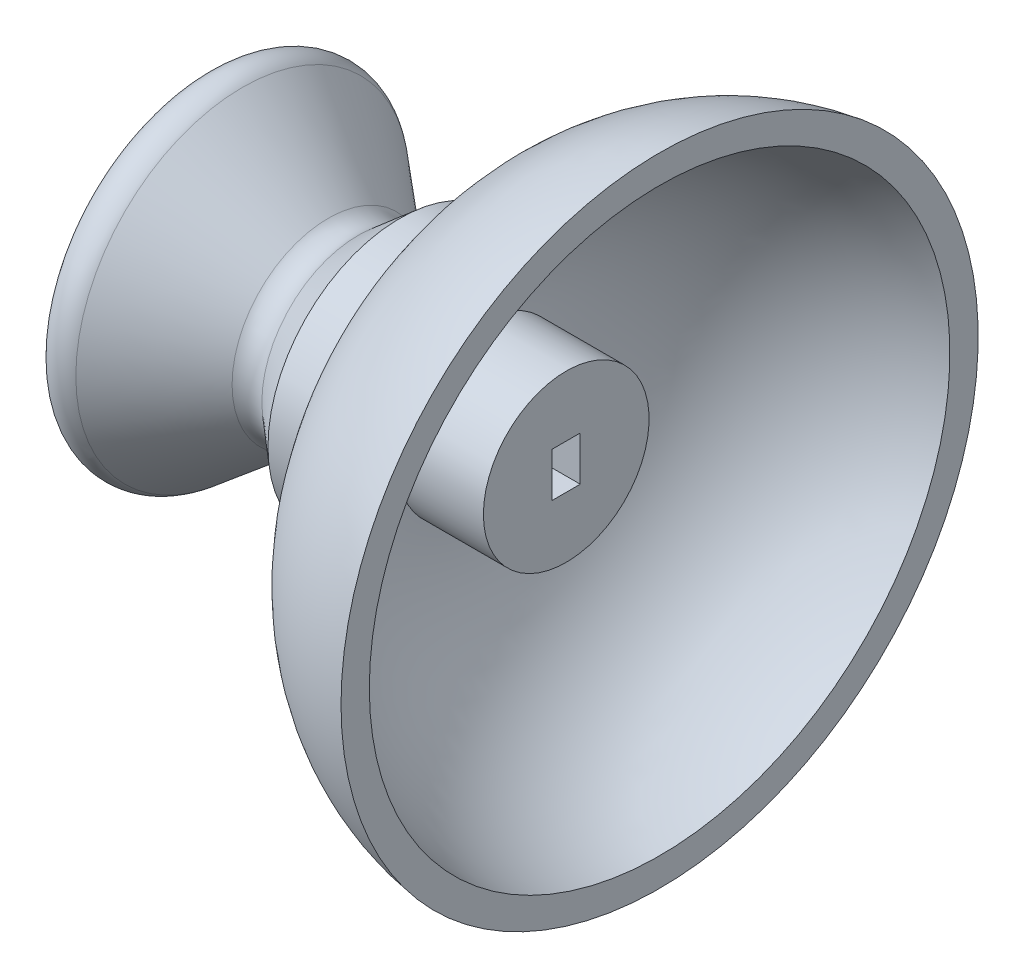
from build123d import *

# Parameters (mm, degrees)
ESQUISSE3_W      = 1.2
ESQUISSE3_H      = 1.9
EXTRUSION2_DEPTH = 4.3
EXTRUSION3_START = -19.35
EXTRUSION3_DEPTH = 1


# Read off the part's stored shape, not the designer's step: Extrusion3
with BuildPart() as part:
    # Esquisse1 → Révolution3 (revolve)
    with BuildSketch(Plane.XY, mode=Mode.PRIVATE) as r_volution3_sk:
        with BuildLine():
            ThreePointArc((-14.261108783, 0.591085315), (-14.902033267, 0.35207293), (-15.546644106, 0.580957137))
            Line((-15.546644106, 0.580957137), (-19.213267485, 3.608715497))
            ThreePointArc((-19.213267485, 3.608715497), (-20.276185104, 3.742266719), (-20.85, 2.837630739))
            Line((-20.85, 2.837630739), (-20.85, 2.110267059))
            Line((-20.85, 2.110267059), (-19.35, -0.039732941))
            Line((-19.35, -0.039732941), (-19.35, -3.539732941))
            Line((-19.35, -3.539732941), (-5.35, -3.539732941))
            Line((-5.35, -3.539732941), (-5.35, 0.010267059))
            Line((-5.35, 0.010267059), (-8.999994144, 0.010267059))
            ThreePointArc((-8.999994144, 0.010267059), (-6.821240137, 5.871173902), (-1.35, 8.89817397))
            Line((-1.35, 8.89817397), (-1.35, 10.110267059))
            ThreePointArc((-1.35, 10.110267059), (-6.934576943, 7.480083062), (-9.979317258, 2.110267059))
            Line((-9.979317258, 2.110267059), (-12.479317258, 2.110267059))
            Line((-12.479317258, 2.110267059), (-14.261108783, 0.591085315))
        make_face()
    revolve(r_volution3_sk.sketch.rotate(Axis((-25.585387416, -3.539732941, 0), (1, 0, 0)), 90), axis=Axis((-25.585387416, -3.539732941, 0), (1, 0, 0)))

    # Esquisse3 → Extrusion2 (cut)
    with BuildSketch(Plane(origin=(-5.35, 0, 0), x_dir=(0, 0, -1), z_dir=(1, 0, 0))):
        with Locations((0, -3.539732941)):
            Rectangle(ESQUISSE3_W, ESQUISSE3_H)
    extrude(amount=-EXTRUSION2_DEPTH, mode=Mode.SUBTRACT)

    # Extrusion3 outline → Extrusion3 (cut)
    with BuildSketch(Plane.YZ.offset(EXTRUSION3_START)):
        with BuildLine():
            add(Edge.make_bspline(
                [(-3.30474087, -3.428116801), (-3.263574617, -3.427584563), (-3.18176531, -3.426526851), (-3.060308003, -3.413701335), (-2.94100731, -3.395299917), (-2.823960754, -3.368252862), (-2.709090162, -3.334156598), (-2.596342199, -3.291603112), (-2.485650327, -3.242058216), (-2.377776459, -3.18447272), (-2.274152046, -3.12038826), (-2.175194243, -3.05083804), (-2.082705178, -2.974834439), (-1.99551353, -2.89361864), (-1.914714683, -2.80622165), (-1.839560572, -2.713462226), (-1.769950386, -2.615268883), (-1.706980551, -2.511332703), (-1.650416931, -2.403205019), (-1.600827719, -2.291145017), (-1.559844404, -2.175186906), (-1.525070624, -2.056199429), (-1.499355483, -1.933281928), (-1.480706738, -1.807326391), (-1.467946138, -1.677676279), (-1.466919883, -1.59004025), (-1.466399524, -1.545604782)],
                knots=[0, 0, 0, 0, 0.04203938, 0.083544465, 0.124643057, 0.165303063, 0.206170747, 0.24697072, 0.288329266, 0.329986533, 0.371797473, 0.412737629, 0.453459281, 0.494001342, 0.534380668, 0.574951545, 0.615891702, 0.657249559, 0.699006607, 0.740486274, 0.782325156, 0.824567455, 0.867041244, 0.910499531, 0.954619176, 1, 1, 1, 1], degree=3))
            add(Edge.make_bspline(
                [(-1.466399524, -1.545604782), (-1.466979016, -1.509366538), (-1.46812808, -1.437510359), (-1.476092728, -1.330584627), (-1.488716609, -1.225311613), (-1.505943396, -1.121535223), (-1.529407086, -1.019608856), (-1.557485371, -0.919242151), (-1.590177193, -0.820289615), (-1.62916604, -0.723061366), (-1.673419665, -0.62690365), (-1.723233087, -0.531281809), (-1.779458092, -0.436522563), (-1.842261627, -0.342461582), (-1.910565045, -0.248505724), (-1.986321869, -0.156141081), (-2.066544624, -0.063138137), (-2.124226808, -0.003336323), (-2.153498883, 0.027011404)],
                knots=[0, 0, 0, 0, 0.061616945, 0.122179161, 0.18221627, 0.241864129, 0.300960056, 0.359969068, 0.419032918, 0.478068687, 0.537992581, 0.59896023, 0.661321079, 0.725247569, 0.791220154, 0.858745972, 0.928317581, 1, 1, 1, 1], degree=3))
            Line((-2.153498883, 0.027011404), (-2.408707216, -0.242219365))
            add(Edge.make_bspline(
                [(-2.408707216, -0.242219365), (-2.362876353, -0.290938253), (-2.27230749, -0.3872143), (-2.154796495, -0.544174543), (-2.054130395, -0.707938177), (-1.972224159, -0.877650673), (-1.906871398, -1.049109227), (-1.860343258, -1.220038004), (-1.83067072, -1.388683705), (-1.827122351, -1.500850923), (-1.825373883, -1.556121609)],
                knots=[0, 0, 0, 0, 0.136144491, 0.269042539, 0.398516618, 0.527099539, 0.652282545, 0.771680405, 0.887494932, 1, 1, 1, 1], degree=3))
            add(Edge.make_bspline(
                [(-1.825373883, -1.556121609), (-1.825787489, -1.590036309), (-1.826613628, -1.657777749), (-1.837157843, -1.758399693), (-1.852322707, -1.85796633), (-1.874264585, -1.956289705), (-1.902073644, -2.053560992), (-1.936859108, -2.149441884), (-1.977414352, -2.244111239), (-2.024276826, -2.33667732), (-2.075756672, -2.426417823), (-2.132805213, -2.511174659), (-2.193594003, -2.591488058), (-2.259644982, -2.665848483), (-2.330359847, -2.73468367), (-2.404423154, -2.799632042), (-2.483858372, -2.858409337), (-2.567203998, -2.911500502), (-2.652996187, -2.958862121), (-2.740409177, -3.000670774), (-2.829153031, -3.035767862), (-2.919339109, -3.063537318), (-3.010269699, -3.086447972), (-3.10257442, -3.102565579), (-3.196352105, -3.111652301), (-3.259149363, -3.113224081), (-3.290718434, -3.114014237)],
                knots=[0, 0, 0, 0, 0.042841197, 0.085571284, 0.127718668, 0.170068387, 0.212787245, 0.255481593, 0.298877091, 0.342860572, 0.386527586, 0.429532376, 0.471886213, 0.513729302, 0.555081706, 0.596535237, 0.638120075, 0.679822212, 0.721331468, 0.761888364, 0.802199329, 0.841806293, 0.881060412, 0.920633226, 0.960101199, 1, 1, 1, 1], degree=3))
            add(Edge.make_bspline(
                [(-3.290718434, -3.114014237), (-3.322989252, -3.113258519), (-3.387442765, -3.111749146), (-3.483636838, -3.102088826), (-3.57840224, -3.084160586), (-3.672050373, -3.060192877), (-3.764741621, -3.030212061), (-3.856074131, -2.992839395), (-3.946044522, -2.948573795), (-4.033842139, -2.897337243), (-4.119365162, -2.841151039), (-4.199924684, -2.778207958), (-4.276593461, -2.711347375), (-4.347669225, -2.638133475), (-4.415053122, -2.560913933), (-4.476888643, -2.477381657), (-4.534366867, -2.389179196), (-4.586763386, -2.296171984), (-4.633571922, -2.199369202), (-4.675195818, -2.100112449), (-4.709475155, -1.998084633), (-4.737413259, -1.893821944), (-4.760313556, -1.787448672), (-4.775046037, -1.678424869), (-4.785736868, -1.567552161), (-4.786518538, -1.492813529), (-4.786912345, -1.45516007)],
                knots=[0, 0, 0, 0, 0.038994203, 0.077881926, 0.116651567, 0.155416065, 0.194618293, 0.234261464, 0.274547108, 0.315667309, 0.357019556, 0.398082512, 0.439097864, 0.479833278, 0.521274132, 0.562840828, 0.605292061, 0.64840866, 0.691727292, 0.735148885, 0.778368925, 0.821660858, 0.865523699, 0.909731498, 0.954522565, 1, 1, 1, 1], degree=3))
            add(Edge.make_bspline(
                [(-4.786912345, -1.45516007), (-4.785963768, -1.409781723), (-4.784101085, -1.320673966), (-4.769600795, -1.189687523), (-4.746954001, -1.063884452), (-4.713788105, -0.943618249), (-4.67148443, -0.828749228), (-4.620489043, -0.718856287), (-4.558845984, -0.614804628), (-4.489272117, -0.516281455), (-4.411757285, -0.425524269), (-4.32811283, -0.343670145), (-4.238744763, -0.272024656), (-4.144179448, -0.209519957), (-4.043634143, -0.157811303), (-3.93760158, -0.115368507), (-3.826034068, -0.082835216), (-3.748942436, -0.069480241), (-3.709989268, -0.062732186)],
                knots=[0, 0, 0, 0, 0.070630068, 0.138693613, 0.204917715, 0.269440883, 0.332636335, 0.395301694, 0.457763931, 0.52065702, 0.582851652, 0.643315198, 0.702580232, 0.760907539, 0.819489613, 0.878269076, 0.938491311, 1, 1, 1, 1], degree=3))
            Line((-3.709989268, -0.062732186), (-3.709989268, -1.229398852))
            Line((-3.709989268, -1.229398852), (-3.351014909, -1.229398852))
            Line((-3.351014909, -1.229398852), (-3.351014909, 0.251370378))
            add(Edge.make_bspline(
                [(-3.351014909, 0.251370378), (-3.417922397, 0.24966453), (-3.548872439, 0.246325877), (-3.73984271, 0.222906961), (-3.920214403, 0.185090449), (-4.090177475, 0.133430137), (-4.249491068, 0.066554856), (-4.398316934, -0.014817672), (-4.535693615, -0.111989793), (-4.662742618, -0.221500235), (-4.776071831, -0.344400192), (-4.875677769, -0.477368812), (-4.959580384, -0.620625781), (-5.027841046, -0.774035588), (-5.081115041, -0.937096022), (-5.118886618, -1.110184401), (-5.141516581, -1.293066002), (-5.144407961, -1.418402679), (-5.145886704, -1.48250382)],
                knots=[0, 0, 0, 0, 0.071272278, 0.139492722, 0.204635419, 0.26740574, 0.328445598, 0.388397163, 0.447733931, 0.507391621, 0.566767555, 0.625478338, 0.684066506, 0.743248446, 0.804033357, 0.866498751, 0.931723238, 1, 1, 1, 1], degree=3))
            add(Edge.make_bspline(
                [(-5.145886704, -1.48250382), (-5.145317582, -1.522013956), (-5.144195092, -1.599940677), (-5.136217744, -1.715031605), (-5.123937168, -1.826949225), (-5.105392045, -1.935677234), (-5.08267739, -2.041615576), (-5.053590672, -2.144235161), (-5.019921972, -2.243926903), (-4.981626299, -2.340844889), (-4.937254642, -2.434109436), (-4.887945003, -2.524135953), (-4.833951642, -2.611422078), (-4.774340796, -2.695373243), (-4.709558336, -2.776426865), (-4.639474417, -2.854060308), (-4.564303297, -2.928708187), (-4.510924288, -2.97546865), (-4.484027729, -2.999030263)],
                knots=[0, 0, 0, 0, 0.069236524, 0.136556739, 0.202094157, 0.26646426, 0.329768823, 0.391878966, 0.453270593, 0.514114664, 0.57438951, 0.634141664, 0.693923287, 0.754152196, 0.814470164, 0.87566063, 0.937348011, 1, 1, 1, 1], degree=3))
            add(Edge.make_bspline(
                [(-4.484027729, -2.999030263), (-4.441357076, -3.033216195), (-4.356724059, -3.101020607), (-4.221124115, -3.188298764), (-4.080722254, -3.262700167), (-3.935127626, -3.323067989), (-3.784476413, -3.370206075), (-3.628961122, -3.404012328), (-3.468381491, -3.423819617), (-3.359716227, -3.426673155), (-3.30474087, -3.428116801)],
                knots=[0, 0, 0, 0, 0.127895677, 0.253668418, 0.376738432, 0.499344473, 0.621999307, 0.745698548, 0.871345153, 1, 1, 1, 1], degree=3))
        make_face()
        with BuildLine():
            add(Edge.make_bspline(
                [(-2.534909139, 2.674447301), (-2.511027741, 2.673811559), (-2.463962091, 2.672558633), (-2.394956332, 2.661500936), (-2.328391518, 2.64479043), (-2.264062899, 2.620845172), (-2.202617247, 2.589238431), (-2.143979766, 2.550765052), (-2.087290801, 2.506374988), (-2.034137503, 2.455023719), (-1.985456298, 2.398612199), (-1.942332212, 2.339017949), (-1.906293101, 2.275967845), (-1.876749604, 2.209727723), (-1.853574223, 2.140482254), (-1.837515644, 2.068097508), (-1.82743316, 1.992773492), (-1.826068988, 1.941339996), (-1.825373883, 1.915132398)],
                knots=[0, 0, 0, 0, 0.061965401, 0.122121906, 0.180988497, 0.239933216, 0.299905831, 0.359988847, 0.421775742, 0.486575826, 0.551534805, 0.615017543, 0.677258617, 0.739729962, 0.803050103, 0.866495132, 0.931973474, 1, 1, 1, 1], degree=3))
            add(Edge.make_bspline(
                [(-1.825373883, 1.915132398), (-1.826088915, 1.887761565), (-1.827493121, 1.834009769), (-1.837315785, 1.755090736), (-1.854261625, 1.679804958), (-1.877438299, 1.607963055), (-1.906896848, 1.539443469), (-1.943588593, 1.474579425), (-1.987372086, 1.413516536), (-2.037012642, 1.356140013), (-2.092280244, 1.303276034), (-2.153890207, 1.256829158), (-2.220717622, 1.216245144), (-2.292582173, 1.18083591), (-2.370135953, 1.15208022), (-2.453103657, 1.13010707), (-2.541125039, 1.112720223), (-2.601910124, 1.106911702), (-2.633066191, 1.103934481)],
                knots=[0, 0, 0, 0, 0.064438672, 0.126546911, 0.186887153, 0.245877536, 0.304040885, 0.362191218, 0.420975933, 0.480660283, 0.540600275, 0.600689098, 0.66193579, 0.724442506, 0.789038394, 0.856313757, 0.926352028, 1, 1, 1, 1], degree=3))
            Line((-2.633066191, 1.103934481), (-2.633066191, 0.789831917))
            add(Edge.make_bspline(
                [(-2.633066191, 0.789831917), (-2.591395303, 0.79187907), (-2.509554788, 0.795899624), (-2.390230882, 0.814727913), (-2.276176083, 0.84166879), (-2.168306169, 0.879760244), (-2.065667362, 0.927066522), (-1.968667346, 0.983796549), (-1.877676158, 1.0509904), (-1.793537314, 1.127197134), (-1.716349744, 1.209965773), (-1.649694501, 1.299271713), (-1.593376829, 1.39311674), (-1.546295588, 1.491216139), (-1.510955742, 1.594676702), (-1.484734102, 1.70255956), (-1.468957756, 1.815338697), (-1.467261971, 1.892178719), (-1.466399524, 1.931258199)],
                knots=[0, 0, 0, 0, 0.068790794, 0.135103289, 0.198978674, 0.2619043, 0.323494969, 0.385195378, 0.446969239, 0.509764777, 0.572250569, 0.633405176, 0.693251163, 0.752583163, 0.812579266, 0.873275085, 0.935549943, 1, 1, 1, 1], degree=3))
            add(Edge.make_bspline(
                [(-1.466399524, 1.931258199), (-1.46729798, 1.969636273), (-1.469063415, 2.045047818), (-1.484224445, 2.155109832), (-1.507970036, 2.259887127), (-1.541285453, 2.359174893), (-1.58606988, 2.452180958), (-1.639867419, 2.539604002), (-1.70208725, 2.622484813), (-1.775341063, 2.697091597), (-1.853543448, 2.765599676), (-1.937031351, 2.824701931), (-2.023260637, 2.875315094), (-2.112888839, 2.917502774), (-2.206759867, 2.948558913), (-2.30350707, 2.972137121), (-2.404131881, 2.985464535), (-2.472238437, 2.987509958), (-2.506864268, 2.988549866)],
                knots=[0, 0, 0, 0, 0.06947546, 0.136516798, 0.200788824, 0.263829673, 0.325735023, 0.387290692, 0.449509219, 0.51296782, 0.576275215, 0.6375801, 0.697902606, 0.757172088, 0.816598528, 0.876653171, 0.937289642, 1, 1, 1, 1], degree=3))
            add(Edge.make_bspline(
                [(-2.506864268, 2.988549866), (-2.555612102, 2.986856603), (-2.652252316, 2.983499791), (-2.794267179, 2.954785415), (-2.931860598, 2.909938904), (-3.0425979, 2.855941547), (-3.131831394, 2.801469103), (-3.205300098, 2.752381595), (-3.284405567, 2.694916784), (-3.368882904, 2.628238286), (-3.459393809, 2.553725414), (-3.555883605, 2.470703251), (-3.657355375, 2.378579769), (-3.726660976, 2.313921268), (-3.762573402, 2.280416853)],
                knots=[0, 0, 0, 0, 0.098702196, 0.195672309, 0.292422427, 0.391342544, 0.444462441, 0.504228775, 0.570352338, 0.642545753, 0.722287505, 0.807921123, 0.900469538, 1, 1, 1, 1], degree=3))
            Line((-3.762573402, 2.280416853), (-4.697168755, 1.404715731))
            Line((-4.697168755, 1.404715731), (-4.697168755, 3.03342166))
            Line((-4.697168755, 3.03342166), (-5.056143114, 3.03342166))
            Line((-5.056143114, 3.03342166), (-5.056143114, 0.655216532))
            Line((-5.056143114, 0.655216532), (-3.607625486, 2.012588327))
            add(Edge.make_bspline(
                [(-3.607625486, 2.012588327), (-3.573127179, 2.045636214), (-3.506862992, 2.109114441), (-3.410120032, 2.198897018), (-3.320370492, 2.279536006), (-3.237783943, 2.351553399), (-3.161152375, 2.413386904), (-3.092957672, 2.468259136), (-3.030203221, 2.512224727), (-2.957462607, 2.559940123), (-2.86865029, 2.606154104), (-2.760116601, 2.64586646), (-2.648389348, 2.670081309), (-2.572887311, 2.672986144), (-2.534909139, 2.674447301)],
                knots=[0, 0, 0, 0, 0.110802644, 0.212829202, 0.30610131, 0.390647321, 0.466924469, 0.534481039, 0.593586941, 0.644557005, 0.736200453, 0.825024026, 0.911985585, 1, 1, 1, 1], degree=3))
        make_face()
    extrude(amount=EXTRUSION3_DEPTH, mode=Mode.SUBTRACT)


solid = part.part
